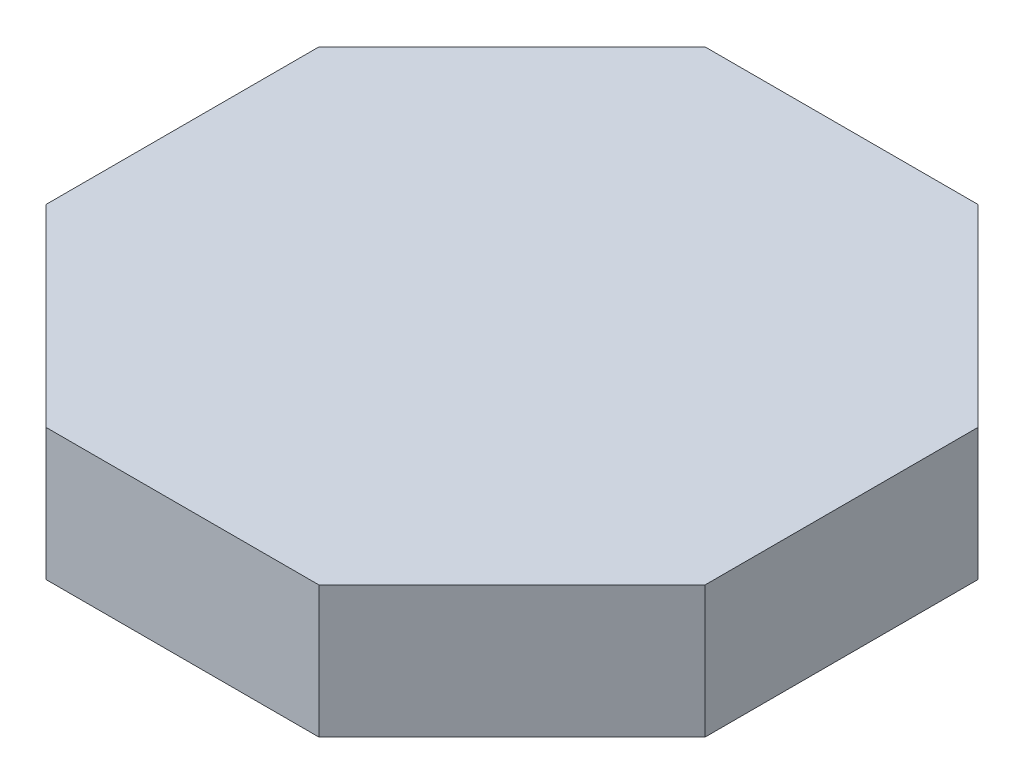
from build123d import *

# Parameters (mm, degrees)
BOSS_EXTRUDE1_DEPTH   = 10
BODY_MOVE_COPY1_DEPTH = 10


# Read off the part's stored shape, not the designer's step: Body-Move/Copy1
with BuildPart() as part:
    # Sketch1 → Boss-Extrude1 (new body)
    with BuildSketch(Plane(origin=(0, 0, 0), x_dir=(1, 0, 0), z_dir=(0, 1, 0))):
        Polygon((-10.355339059, 25), (-25, 10.355339059), (-25, -10.355339059), (-10.355339059, -25), (10.355339059, -25), (25, -10.355339059), (25, 10.355339059), (10.355339059, 25), align=None)
    extrude(amount=BOSS_EXTRUDE1_DEPTH)


with BuildPart() as body_2:
    # Body-Move/Copy1 outline → Body-Move/Copy1 (new body)
    with BuildSketch(Plane(origin=(0, 0, 0), x_dir=(1, 0, 0), z_dir=(0, 1, 0))):
        Polygon((10.355339059, 25), (-10.355339059, 25), (-25, 10.355339059), (-25, -10.355339059), (-10.355339059, -25), (10.355339059, -25), (25, -10.355339059), (25, 10.355339059), align=None)
    extrude(amount=BODY_MOVE_COPY1_DEPTH)


solid = Compound([part.part, body_2.part])
